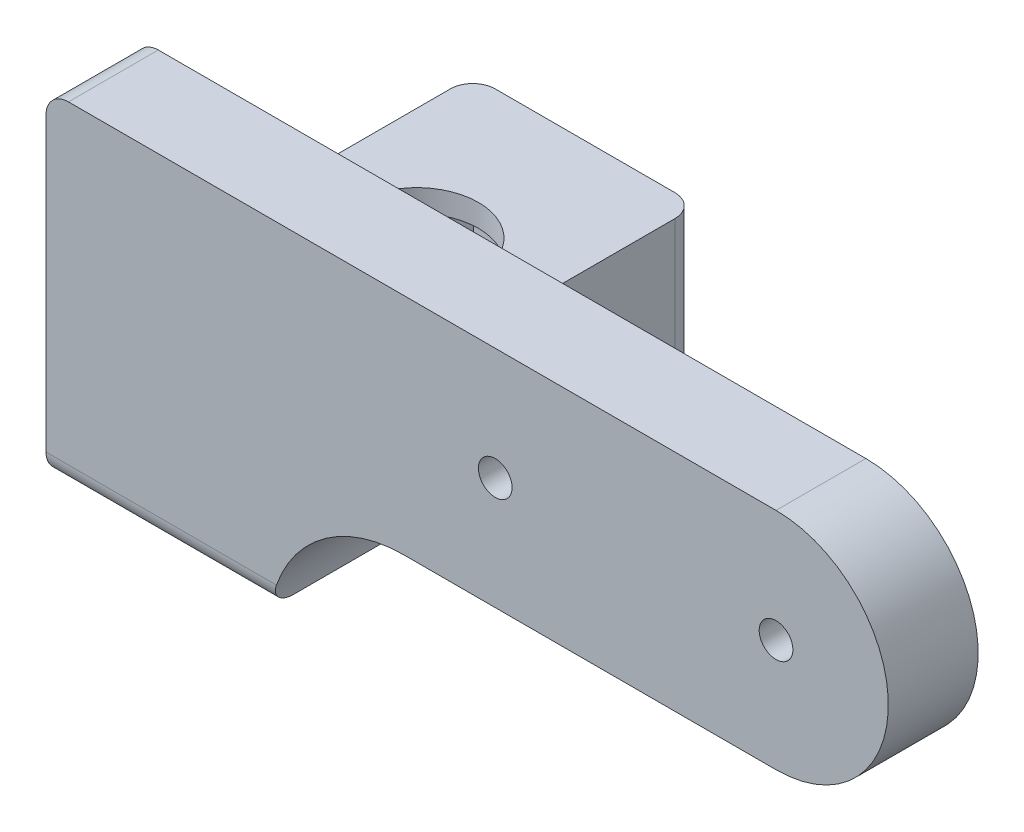
from build123d import *

# Parameters (mm, degrees)
BOSS_EXTRUDE1_DEPTH      = 8
SKETCH2_R                = 1.5
CUT_EXTRUDE1_DEPTH       = 10
SKETCH3_R                = 1.5
CUT_EXTRUDE2_DEPTH       = 10
BOSS_EXTRUDE3_DEPTH      = 30
BOSS_EXTRUDE3_DEPTH_BACK = 8
SKETCH6_W                = 20
SKETCH6_H                = 10
FILLET3_R                = 12
SKETCH7_W                = 20
SKETCH7_H                = 30
BOSS_EXTRUDE4_DEPTH      = 2
CUT_EXTRUDE3_DEPTH       = 10
SKETCH9_R                = 5.5
CUT_EXTRUDE4_DEPTH       = 10
FILLET4_R                = 5
FILLET5_R                = 2


with BuildPart() as part:
    # Sketch1 → Boss-Extrude1 (new body)
    with BuildSketch(Plane.XY):
        with BuildLine():
            Line((-25, 10), (40, 10))
            ThreePointArc((40, 10), (50, 0), (40, -10))
            Line((40, -10), (-25, -10))
            Line((-25, -10), (-25, 10))
        make_face()
    extrude(amount=BOSS_EXTRUDE1_DEPTH)

    # Sketch2 → Cut-Extrude1 (cut)
    with BuildSketch(Plane.XY.offset(8)):
        with Locations((40, 0)):
            Circle(SKETCH2_R)
    extrude(amount=-CUT_EXTRUDE1_DEPTH, mode=Mode.SUBTRACT)

    # Sketch3 → Cut-Extrude2 (cut)
    with BuildSketch(Plane(origin=(0, 0, 0), x_dir=(-1, 0, 0), z_dir=(0, 0, -1))):
        with Locations((-15, 0)):
            Circle(SKETCH3_R)
    extrude(amount=-CUT_EXTRUDE2_DEPTH, mode=Mode.SUBTRACT)

    # Sketch6 → Boss-Extrude3 (add, two sides: drawn at the far end of the back side and taken through both)
    with BuildSketch(Plane(origin=(0, 0, 0), x_dir=(-1, 0, 0), z_dir=(0, 0, -1)).offset(-BOSS_EXTRUDE3_DEPTH_BACK)):
        with Locations((15, -15)):
            Rectangle(SKETCH6_W, SKETCH6_H)
    extrude(amount=BOSS_EXTRUDE3_DEPTH + BOSS_EXTRUDE3_DEPTH_BACK)

    # Fillet3
    # the kernel refuses this fillet: 12 mm, written as the material it adds along each edge
    with BuildSketch(Plane(origin=(-5, -10, 8), x_dir=(0, -1, 0), z_dir=(0, 0, -1))) as fillet3_piece_1:
        with BuildLine():
            CenterArc((12, -11.832159566), FILLET3_R, 99.594068227, 80.405931773)
            Line((0, -11.832159566), (0, 0))
            Line((0, 0), (10, 0))
        make_face()
    extrude(amount=8)

    # Sketch7 → Boss-Extrude4 (add)
    with BuildSketch(Plane(origin=(0, -10, 0), x_dir=(1, 0, 0), z_dir=(0, 1, 0))):
        with Locations((-15, 15)):
            Rectangle(SKETCH7_W, SKETCH7_H)
    extrude(amount=BOSS_EXTRUDE4_DEPTH)

    # Sketch8 → Cut-Extrude3 (cut)
    with BuildSketch(Plane.XZ.offset(20)):
        Polygon((-12.092828782, -7.012612723), (-20.463694682, -8.488622233), (-23.370865901, -16.47600951), (-17.907171218, -22.987387277), (-9.536305318, -21.511377767), (-6.629134099, -13.52399049), align=None)
    extrude(amount=-CUT_EXTRUDE3_DEPTH, mode=Mode.SUBTRACT)

    # Sketch9 → Cut-Extrude4 (cut)
    with BuildSketch(Plane.XZ.offset(10)):
        with Locations(Location((-15, -15, 0), (0, 0, 270))):
            Circle(SKETCH9_R)
    extrude(amount=-CUT_EXTRUDE4_DEPTH, mode=Mode.SUBTRACT)

    # Fillet4
    # the kernel refuses this fillet: 5 mm, written as the material it adds along each edge
    with BuildSketch(Plane(origin=(-5, -20, 0), x_dir=(1, 0, 0), z_dir=(0, 1, 0))) as fillet4_piece_1_section:
        with BuildLine():
            CenterArc((FILLET4_R, FILLET4_R), FILLET4_R, 180, 90)
            Line((0, FILLET4_R), (0, 0))
            Line((0, 0), (FILLET4_R, 0))
        make_face()
    fillet4_piece_1 = extrude(amount=12, mode=Mode.PRIVATE)
    fillet4_piece_1 = fillet4_piece_1 - Plane(origin=(6.832159566, -22, 0), x_dir=(0, -1, 0), z_dir=(0, 0, 1)) * Cylinder(12, 44, mode=Mode.PRIVATE)
    add(fillet4_piece_1)
    with BuildSketch(Plane(origin=(-25, -8, 0), x_dir=(0, 1, 0), z_dir=(1, 0, 0))) as fillet4_piece_2:
        with BuildLine():
            CenterArc((FILLET4_R, -FILLET4_R), FILLET4_R, 90, 90)
            Line((0, -FILLET4_R), (0, 0))
            Line((0, 0), (FILLET4_R, 0))
        make_face()
    extrude(amount=20)
    with BuildSketch(Plane(origin=(-5, -20, 0), x_dir=(1, 0, 0), z_dir=(0, 1, 0))) as fillet4_piece_3a_section:
        with BuildLine():
            CenterArc((FILLET4_R, FILLET4_R), FILLET4_R, 180, 90)
            Line((0, FILLET4_R), (0, 0))
            Line((0, 0), (FILLET4_R, 0))
        make_face()
    fillet4_piece_3a = extrude(amount=24.5, mode=Mode.PRIVATE)
    fillet4_piece_3a = split(fillet4_piece_3a, bisect_by=Plane(origin=(-5, -8, 0), z_dir=(0, 1, 0)), keep=Keep.TOP, mode=Mode.PRIVATE)
    with BuildSketch(Plane(origin=(-25, -8, 0), x_dir=(0, 1, 0), z_dir=(1, 0, 0))) as fillet4_piece_3b_section:
        with BuildLine():
            CenterArc((FILLET4_R, -FILLET4_R), FILLET4_R, 90, 90)
            Line((0, -FILLET4_R), (0, 0))
            Line((0, 0), (FILLET4_R, 0))
        make_face()
    fillet4_piece_3b = extrude(amount=32.5, mode=Mode.PRIVATE)
    fillet4_piece_3b = split(fillet4_piece_3b, bisect_by=Plane(origin=(-5, -8, 0), z_dir=(1, 0, 0)), keep=Keep.TOP, mode=Mode.PRIVATE)
    fillet4_piece_3 = fillet4_piece_3a & fillet4_piece_3b
    add(fillet4_piece_3)

    # Fillet5
    fillet5_edges = [part.edges().sort_by_distance(p)[0] for p in [
        (-15, -20, 8),
        (-25, -14, -30),
        (-5, -14, -30),
        (-25, 10, 4),
    ]]
    fillet(fillet5_edges, radius=FILLET5_R)


solid = part.part
